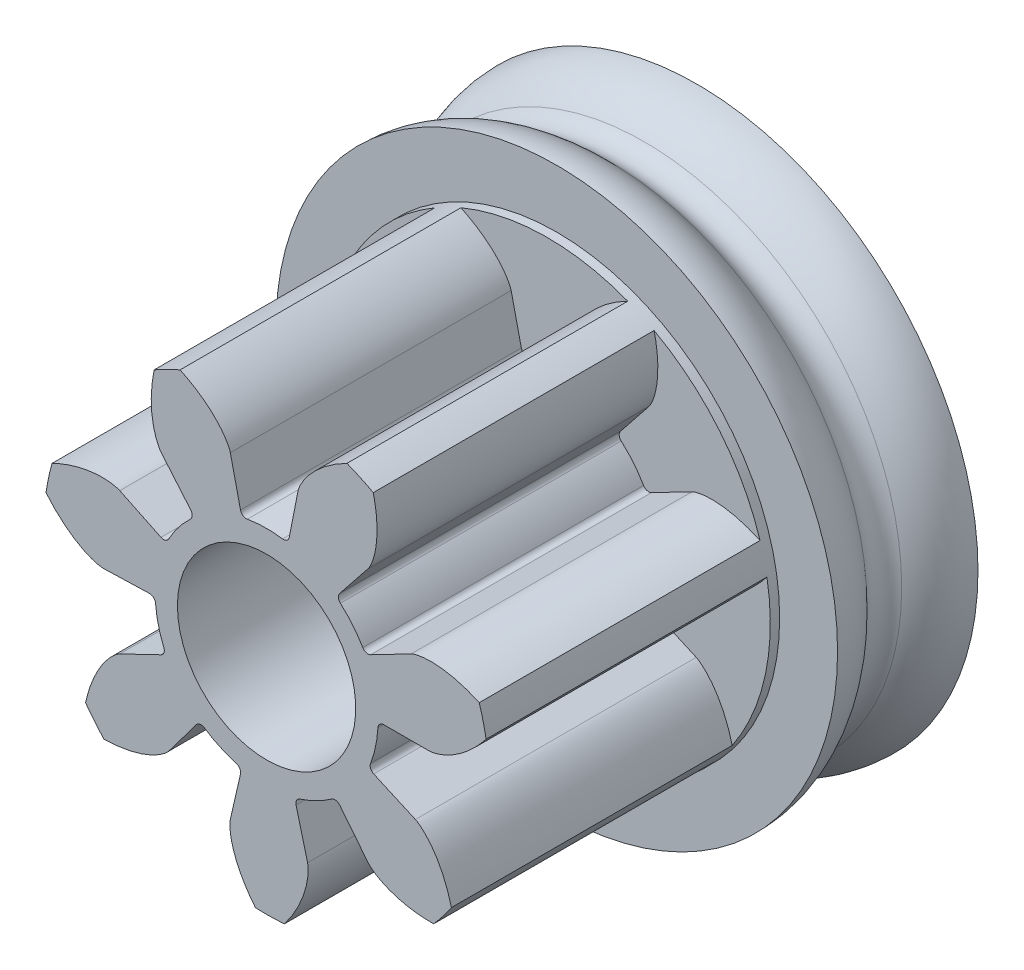
from build123d import *

# Parameters (mm, degrees)
SKETCH2_R                = 9.525
BOSS_EXTRUDE1_DEPTH      = 12
CUT_EXTRUDE1_DEPTH       = 12
FILLET1_R                = 0.254
CIRPATTERN3_COUNT        = 7
FILLET1_OF_CIRPATTERN3_R = 0.254
SKETCH3_R                = 3.81
CUT_EXTRUDE2_DEPTH       = 18.988141274
BOSS_EXTRUDE3_START      = 0.4
SKETCH6_R                = 9.525
SKETCH6_R_2              = 3.81
BOSS_EXTRUDE3_DEPTH      = 0.4
BOSS_EXTRUDE2_START      = 6
SKETCH4_R                = 12
SKETCH4_R_2              = 3.81
BOSS_EXTRUDE2_DEPTH      = 6


# Read off the part's stored shape, not the designer's step: Cut-Extrude1
with BuildPart() as part:
    # Sketch2 → Boss-Extrude1 (new body)
    with BuildSketch(Plane.XY):
        Circle(SKETCH2_R)
    extrude(amount=BOSS_EXTRUDE1_DEPTH)

    # Cut-Extrude1 outline → Cut-Extrude1 (cut)
    with BuildSketch(Plane.XY):
        with BuildLine():
            add(Edge.make_bspline(
                [(7.897843079, -5.324443605), (7.889143341, -5.289999139), (7.867227424, -5.205648747), (7.827727113, -5.060059729), (7.771666127, -4.883663277), (7.701398596, -4.679948485), (7.625552695, -4.488360923), (7.541233, -4.294097512), (7.449800697, -4.106928499), (7.349957655, -3.921669386), (7.243971635, -3.745871788), (7.144005576, -3.596252965), (7.053247562, -3.472826422), (6.97418145, -3.373120571), (6.906540088, -3.293141366), (6.83627385, -3.215340389), (6.763281904, -3.140161429), (6.687469161, -3.067922243), (6.615142647, -3.004844734), (6.547015129, -2.950588631), (6.487230743, -2.907407915), (6.439655955, -2.876083449), (6.401232447, -2.853389362), (6.377134376, -2.840501757), (6.364085781, -2.83432127), (6.359383216, -2.832226927)],
                knots=[0.125661341, 0.125661341, 0.125661341, 0.125661341, 0.125661341, 0.164197228, 0.218929529, 0.273661934, 0.328394301, 0.383126635, 0.43785898, 0.492591256, 0.547323565, 0.602055884, 0.652783571, 0.680149903, 0.707515961, 0.734882063, 0.762248421, 0.789614741, 0.816980391, 0.844236067, 0.862480777, 0.880559096, 0.894007228, 0.903714168, 0.909090916, 0.909090916, 0.909090916, 0.909090916, 0.909090916], degree=4))
            ThreePointArc((7.897843079, -5.324443605), (9.316745812, -1.980876693), (9.380868546, 1.6507363))
            add(Edge.make_bspline(
                [(6.961556166, 0), (6.966704019, 0), (6.981138372, 0.000337209), (7.008395135, 0.002306025), (7.052727841, 0.007404928), (7.10893141, 0.016664594), (7.181112025, 0.031787617), (7.265419984, 0.053633703), (7.357152611, 0.081829835), (7.45579723, 0.116976829), (7.553061062, 0.155956916), (7.648901697, 0.198441138), (7.743230692, 0.24398307), (7.856021752, 0.302897275), (7.989143851, 0.378723625), (8.141333522, 0.474730445), (8.309672953, 0.592202432), (8.476250078, 0.720816713), (8.635921012, 0.854597498), (8.791980848, 0.997752698), (8.939211234, 1.141910972), (9.086279598, 1.299416968), (9.209256135, 1.437747419), (9.304570852, 1.554672786), (9.358908009, 1.622810658), (9.380868546, 1.6507363)],
                knots=[0, 0, 0, 0, 0, 0.005376748, 0.015083688, 0.02853182, 0.046610139, 0.064854849, 0.092110525, 0.119476175, 0.146842495, 0.174208853, 0.201574955, 0.228941013, 0.256307345, 0.307035032, 0.361767351, 0.41649966, 0.471231936, 0.525964281, 0.580696615, 0.635428982, 0.690161387, 0.744893688, 0.783429575, 0.783429575, 0.783429575, 0.783429575, 0.783429575], degree=4))
            Line((6.961556166, 0), (4.7625, 0))
            ThreePointArc((4.7625, 0), (4.658372906, -0.990438347), (4.350544885, -1.937566891))
            Line((4.350544885, -1.937566891), (6.359383216, -2.832226927))
        make_face()
    cut_extrude1 = extrude(amount=CUT_EXTRUDE1_DEPTH, mode=Mode.SUBTRACT)

    # Fillet1
    fillet1_edges = [part.edges().sort_by_distance(p)[0] for p in [
        (4.350544885, -1.937566891, 6),
        (4.7625, 0, 6),
    ]]
    fillet(fillet1_edges, radius=FILLET1_R)

    # CirPattern3: Cut-Extrude1 ×7 about axis
    cirpattern3_axis = Axis((0, 0, 55), (0, 0, -1))
    for i in range(1, CIRPATTERN3_COUNT):
        add(cut_extrude1.rotate(cirpattern3_axis, i * 360 / CIRPATTERN3_COUNT), mode=Mode.SUBTRACT)

    # Fillet1 of CirPattern3
    fillet1_of_cirpattern3_edges = [part.edges().sort_by_distance(p)[0] for p in [
        (1.197669574, -4.609446154, 6),
        (2.969370181, -3.723472435, 6),
        (-2.857075355, -3.810318447, 6),
        (-1.059755948, -4.643094182, 6),
        (-4.760384267, -0.141943234, 6),
        (-4.290864233, -2.066371308, 6),
        (-3.079026732, 3.63331813, 6),
        (-4.290864233, 2.066371308, 6),
        (0.920900733, 4.672616836, 6),
        (-1.059755948, 4.643094182, 6),
        (4.227371163, 2.19333976, 6),
        (2.969370181, 3.723472435, 6),
    ]]
    fillet(fillet1_of_cirpattern3_edges, radius=FILLET1_OF_CIRPATTERN3_R)

    # Sketch3 → Cut-Extrude2 (cut, through all)
    with BuildSketch(Plane(origin=(0, 0, 0), x_dir=(-1, 0, 0), z_dir=(0, 0, -1))):
        Circle(SKETCH3_R)
    extrude(amount=-CUT_EXTRUDE2_DEPTH, mode=Mode.SUBTRACT)

    # Sketch6 → Boss-Extrude3 (add)
    with BuildSketch(Plane(origin=(0, 0, 0), x_dir=(-1, 0, 0), z_dir=(0, 0, -1)).offset(BOSS_EXTRUDE3_START)):
        Circle(SKETCH6_R)
        Circle(SKETCH6_R_2, mode=Mode.SUBTRACT)
    extrude(amount=-BOSS_EXTRUDE3_DEPTH)

    # Sketch4 → Boss-Extrude2 (add)
    with BuildSketch(Plane(origin=(0, 0, -0.4), x_dir=(-1, 0, 0), z_dir=(0, 0, -1)).offset(BOSS_EXTRUDE2_START)):
        Circle(SKETCH4_R)
        Circle(SKETCH4_R_2, mode=Mode.SUBTRACT)
    extrude(amount=-BOSS_EXTRUDE2_DEPTH)

    # Sketch5 → Cut-Revolve1 (revolve, cut)
    with BuildSketch(Plane(origin=(0, 0, 0), x_dir=(0, 0, -1), z_dir=(1, 0, 0)), mode=Mode.PRIVATE) as cut_revolve1_sk:
        with BuildLine():
            Line((6.4, 12), (6.4, 16.999713514))
            Line((6.4, 16.999713514), (0.4, 16.999713514))
            Line((0.4, 16.999713514), (0.4, 12))
            ThreePointArc((0.4, 12), (1.635641853, 11.738831457), (2.65992105, 11))
            ThreePointArc((2.65992105, 11), (3.4, 10.672519998), (4.14007895, 11))
            ThreePointArc((4.14007895, 11), (5.164358147, 11.738831457), (6.4, 12))
        make_face()
    revolve(cut_revolve1_sk.sketch.rotate(Axis((0, 0, 0), (0, 0, -1)), 90), axis=Axis((0, 0, 0), (0, 0, -1)), mode=Mode.SUBTRACT)


solid = part.part
